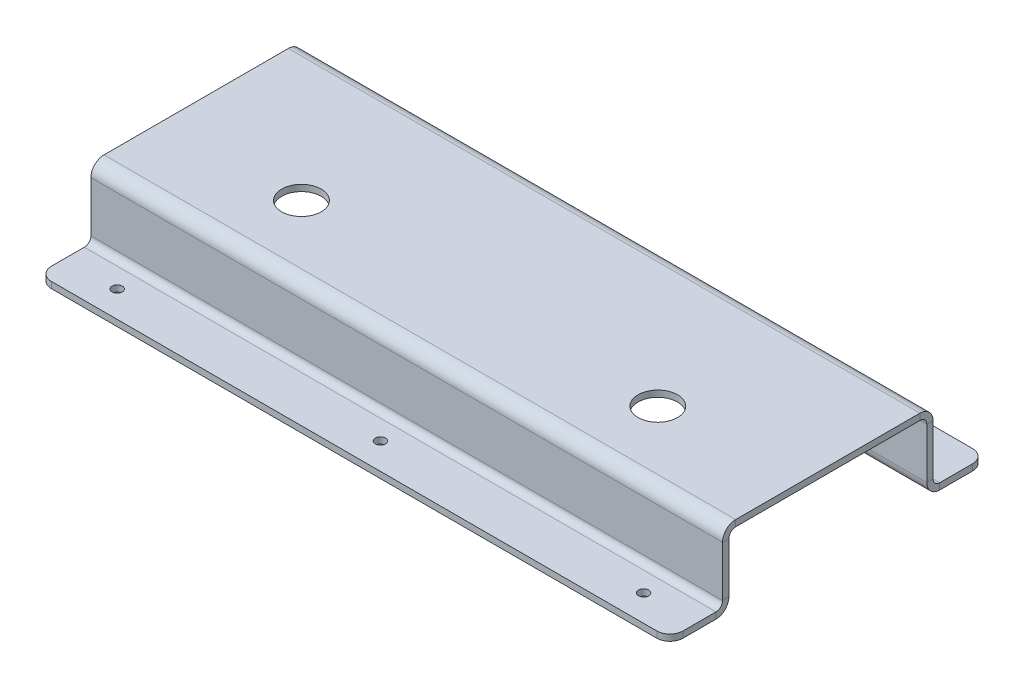
from build123d import *

# Parameters (mm, degrees)
BOSS_EXTRUDE1_DEPTH              = 304.8
SKETCH2_R                        = 2.3876
CUT_EXTRUDE1_DEPTH               = 317.354227758
SKETCH3_R                        = 9.525
CUT_EXTRUDE2_DEPTH               = 304.8
LPATTERN1_COUNT                  = 2
LPATTERN1_PITCH                  = 171.958
FILLET1_R                        = 6.35
CONVERT_SOLID1_DEPTH             = 304.8
F_10_0_1935_DIAMETER_HOLE1_D     = 4.9149
F_10_0_1935_DIAMETER_HOLE1_DEPTH = 3.048


# Read off the part's stored shape, not the designer's step: Convert-Solid1
with BuildPart() as part:
    # Sketch1 → Boss-Extrude1 (new body)
    with BuildSketch(Plane(origin=(0, 0, 0), x_dir=(0, 0, -1), z_dir=(1, 0, 0))):
        with BuildLine():
            Line((-76.2, 4.2545), (-53.975, 4.2545))
            ThreePointArc((-53.975, 4.2545), (-49.484871939, 6.114371939), (-47.625, 10.6045))
            Line((-47.625, 10.6045), (-47.625, 34.925))
            ThreePointArc((-47.625, 34.925), (-46.69506403, 37.17006403), (-44.45, 38.1))
            Line((-44.45, 38.1), (44.45, 38.1))
            ThreePointArc((44.45, 38.1), (46.69506403, 37.17006403), (47.625, 34.925))
            Line((47.625, 34.925), (47.625, 10.6045))
            ThreePointArc((47.625, 10.6045), (49.484871939, 6.114371939), (53.975, 4.2545))
            Line((53.975, 4.2545), (76.2, 4.2545))
            Line((76.2, 4.2545), (76.2, 7.4295))
            Line((76.2, 7.4295), (53.975, 7.4295))
            ThreePointArc((53.975, 7.4295), (51.72993597, 8.35943597), (50.8, 10.6045))
            Line((50.8, 10.6045), (50.8, 34.925))
            ThreePointArc((50.8, 34.925), (48.940128061, 39.415128061), (44.45, 41.275))
            Line((44.45, 41.275), (-44.45, 41.275))
            ThreePointArc((-44.45, 41.275), (-48.940128061, 39.415128061), (-50.8, 34.925))
            Line((-50.8, 34.925), (-50.8, 10.6045))
            ThreePointArc((-50.8, 10.6045), (-51.72993597, 8.35943597), (-53.975, 7.4295))
            Line((-53.975, 7.4295), (-76.2, 7.4295))
            Line((-76.2, 7.4295), (-76.2, 4.2545))
        make_face()
    extrude(amount=BOSS_EXTRUDE1_DEPTH)

    # Sketch2 → Cut-Extrude1 (cut, through all)
    with BuildSketch(Plane.XZ.offset(-4.2545)):
        with Locations(Location((25.4, 63.5, 0), (0, 0, 270))):
            Circle(SKETCH2_R)
        with Locations(Location((152.4, 63.5, 0), (0, 0, 270))):
            Circle(SKETCH2_R)
        with Locations(Location((279.4, 63.5, 0), (0, 0, 270))):
            Circle(SKETCH2_R)
    cut_extrude1 = extrude(amount=-CUT_EXTRUDE1_DEPTH, mode=Mode.SUBTRACT)

    # Mirror1: Cut-Extrude1 across plane
    add(cut_extrude1.mirror(Plane.XY), mode=Mode.SUBTRACT)

    # Sketch3 → Cut-Extrude2 (cut)
    with BuildSketch(Plane(origin=(0, 41.275, 0), x_dir=(1, 0, 0), z_dir=(0, 1, 0))):
        with Locations(Location((66.675, -15.875, 0), (0, 0, 270))):
            Circle(SKETCH3_R)
    cut_extrude2 = extrude(amount=-CUT_EXTRUDE2_DEPTH, mode=Mode.SUBTRACT)

    # LPattern1: Cut-Extrude2 ×2
    with Locations(*[(i * LPATTERN1_PITCH, 0, 0) for i in range(1, LPATTERN1_COUNT)]):
        add(cut_extrude2, mode=Mode.SUBTRACT)

    # Fillet1
    fillet1_edges = [part.edges().sort_by_distance(p)[0] for p in [
        (0, 5.842, -76.2),
        (0, 5.842, 76.2),
        (304.8, 5.842, -76.2),
        (304.8, 5.842, 76.2),
    ]]
    fillet(fillet1_edges, radius=FILLET1_R)

    # Convert-Solid1 outline → Convert-Solid1 (cut)
    with BuildSketch(Plane.YZ):
        with BuildLine():
            Line((4.3815, -76.2), (4.3815, -53.975))
            ThreePointArc((4.3815, -53.975), (6.204174501, -49.574674501), (10.6045, -47.752))
            Line((10.6045, -47.752), (34.925, -47.752))
            ThreePointArc((34.925, -47.752), (37.259866591, -46.784866591), (38.227, -44.45))
            Line((38.227, -44.45), (38.227, 44.45))
            ThreePointArc((38.227, 44.45), (37.259866591, 46.784866591), (34.925, 47.752))
            Line((34.925, 47.752), (10.6045, 47.752))
            ThreePointArc((10.6045, 47.752), (6.204174501, 49.574674501), (4.3815, 53.975))
            Line((4.3815, 53.975), (4.3815, 76.2))
            Line((4.3815, 76.2), (4.2545, 76.2))
            Line((4.2545, 76.2), (4.2545, 53.975))
            ThreePointArc((4.2545, 53.975), (6.114371939, 49.484871939), (10.6045, 47.625))
            Line((10.6045, 47.625), (34.925, 47.625))
            ThreePointArc((34.925, 47.625), (37.17006403, 46.69506403), (38.1, 44.45))
            Line((38.1, 44.45), (38.1, -44.45))
            ThreePointArc((38.1, -44.45), (37.17006403, -46.69506403), (34.925, -47.625))
            Line((34.925, -47.625), (10.6045, -47.625))
            ThreePointArc((10.6045, -47.625), (6.114371939, -49.484871939), (4.2545, -53.975))
            Line((4.2545, -53.975), (4.2545, -76.2))
            Line((4.2545, -76.2), (4.3815, -76.2))
        make_face()
    extrude(amount=CONVERT_SOLID1_DEPTH, mode=Mode.SUBTRACT)

    # #10 (0.1935) Diameter Hole1
    with Locations(Plane(origin=(0, 7.4295, 0), x_dir=(1, 0, 0), z_dir=(0, 1, 0))):
        with Locations((25.4, 63.5), (152.4, 63.5), (279.4, 63.5), (279.4, -63.5), (152.4, -63.5), (25.4, -63.5)):
            Hole(F_10_0_1935_DIAMETER_HOLE1_D / 2, depth=F_10_0_1935_DIAMETER_HOLE1_DEPTH)


solid = part.part
